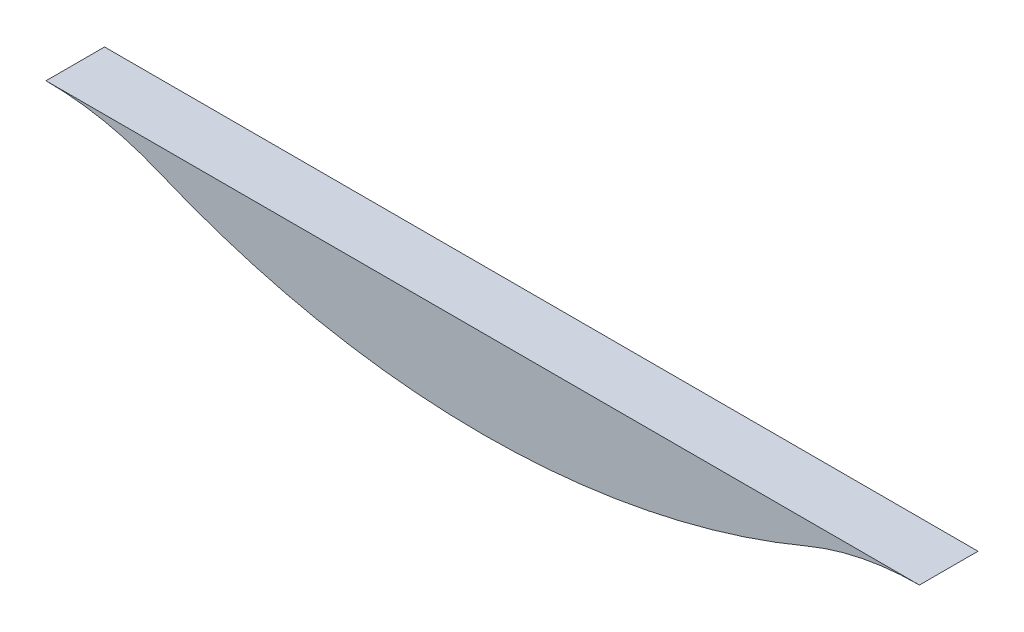
from build123d import *

# Parameters (mm, degrees)
SKETCH1_W           = 86.926834258
SKETCH1_H           = 6.720778705
BASE_EXTRUDE_DEPTH  = 20
BOSS_EXTRUDE1_DEPTH = 1
FILLET1_R           = 10
SKETCH3_W           = 40
SKETCH3_H           = 6.720778705
CUT_EXTRUDE1_DEPTH  = 90.450787478


with BuildPart() as part:
    # Sketch1 → Base-Extrude (new, symmetric)
    with BuildSketch(Plane.XY):
        with Locations((0, 3.360389353)):
            Rectangle(SKETCH1_W, SKETCH1_H)
    extrude(amount=BASE_EXTRUDE_DEPTH, both=True)

    # Sketch2 → Boss-Extrude1 (add, symmetric)
    with BuildSketch(Plane.XY):
        with BuildLine():
            Line((-12.75, 0), (12.75, 0))
            ThreePointArc((12.75, 0), (0, -3), (-12.75, 0))
        make_face()
    extrude(amount=BOSS_EXTRUDE1_DEPTH, both=True)

    # Fillet1
    fillet1_edges = [part.edges().sort_by_distance(p)[0] for p in [
        (12.75, 0, 0),
        (-12.75, 0, 0),
    ]]
    fillet(fillet1_edges, radius=FILLET1_R)

    # Sketch3 → Cut-Extrude1 (cut, through all)
    with BuildSketch(Plane(origin=(43.463417129, 0, 0), x_dir=(0, 0, -1), z_dir=(1, 0, 0))):
        with Locations((0, 3.360389353)):
            Rectangle(SKETCH3_W, SKETCH3_H)
    extrude(amount=-CUT_EXTRUDE1_DEPTH, mode=Mode.SUBTRACT)


solid = part.part
